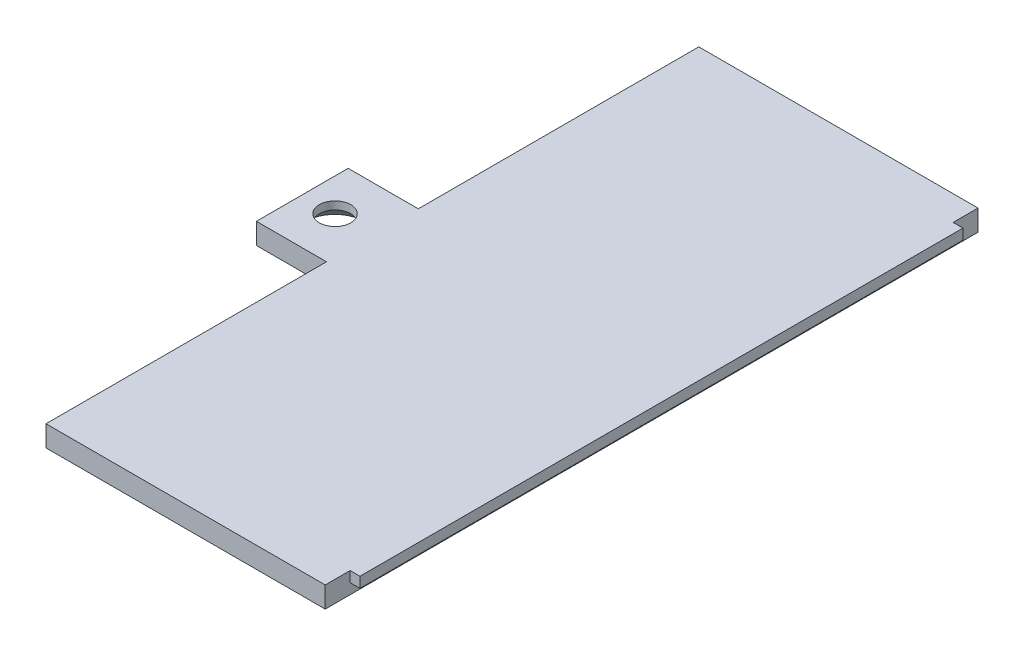
from build123d import *

# Parameters (mm, degrees)
DOOR_PLATE_1_6_CENTRED_SCREW_TAB_DEPTH        = 1.6
SCREW_HOLE_2_4_FREE_SKETCH_R                  = 1.2
SCREW_HOLE_2_4_FREE_DEPTH                     = 72.791312148
SCREW_CSK_90DEG_M2_SIZE                       = 1
HOOK_FLANGE_0_75_X_0_8_INNER_FACE_P_2_W       = 0.9
HOOK_FLANGE_0_75_X_0_8_INNER_FACE_P_2_H       = 46
HOOK_FLANGE_0_75_X_0_8_INNER_FACE_PLANE_DEPTH = 0.8


with BuildPart() as part:
    # Door Plate 1.6 + centred screw tab Sketch → Door Plate 1.6 + centred screw tab (new body)
    with BuildSketch(Plane(origin=(0, 0, 0), x_dir=(1, 0, 0), z_dir=(0, 1, 0))):
        Polygon((9.35, 15.1), (30.65, 15.1), (30.65, 64.9), (9.35, 64.9), (9.35, 43.5), (4, 43.5), (4, 36.5), (9.35, 36.5), align=None)
    extrude(amount=DOOR_PLATE_1_6_CENTRED_SCREW_TAB_DEPTH)

    # Screw Hole 2.4 (free) Sketch → Screw Hole 2.4 (free) (cut, through all)
    with BuildSketch(Plane(origin=(0, 0, 0), x_dir=(1, 0, 0), z_dir=(0, 1, 0))):
        with Locations((6.5, 40)):
            Circle(SCREW_HOLE_2_4_FREE_SKETCH_R)
    extrude(amount=SCREW_HOLE_2_4_FREE_DEPTH, mode=Mode.SUBTRACT)

    # Screw CSK 90deg (M2)
    screw_csk_90deg_m2_edges = [part.edges().sort_by_distance(p)[0] for p in [
        (5.3, 0, -40),
    ]]
    chamfer(screw_csk_90deg_m2_edges, length=SCREW_CSK_90DEG_M2_SIZE)

    # Hook Flange 0.75 x 0.8 _inner-face p 2 → Hook Flange 0.75 x 0.8 _inner-face plane (add)
    with BuildSketch(Plane(origin=(0, 0.8, 0), x_dir=(1, 0, 0), z_dir=(0, 1, 0))):
        with Locations((30.95, 40)):
            Rectangle(HOOK_FLANGE_0_75_X_0_8_INNER_FACE_P_2_W, HOOK_FLANGE_0_75_X_0_8_INNER_FACE_P_2_H)
    extrude(amount=HOOK_FLANGE_0_75_X_0_8_INNER_FACE_PLANE_DEPTH)


solid = part.part
